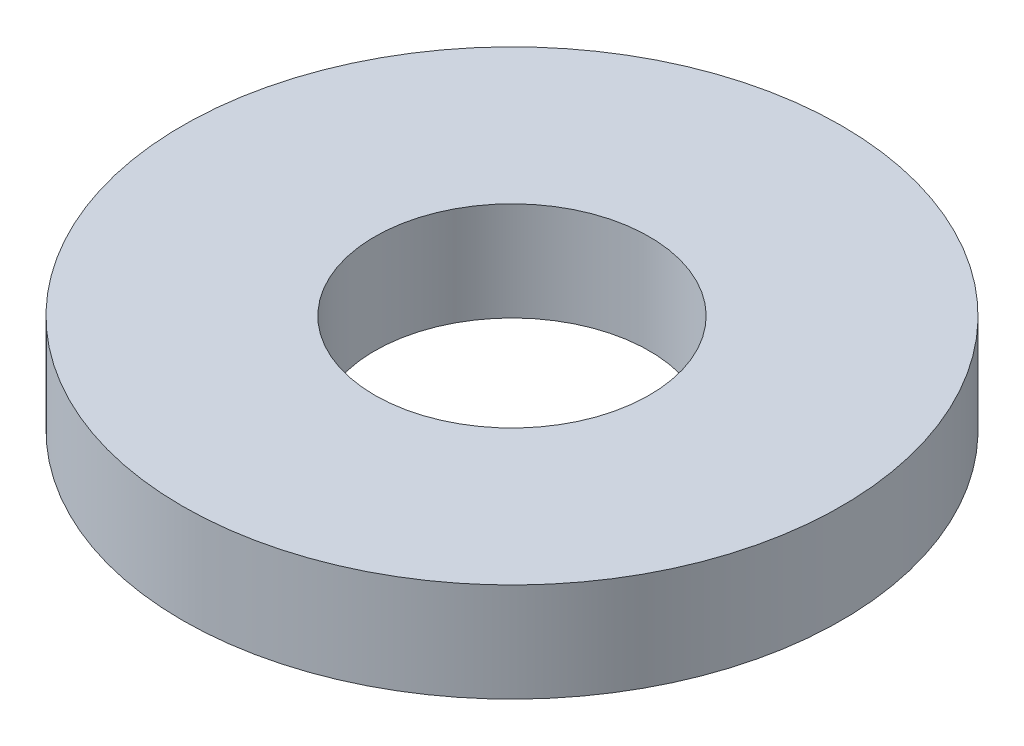
from build123d import *

# Parameters (mm, degrees)
SKETCH1_R           = 60
BOSS_EXTRUDE1_DEPTH = 18
SKETCH2_R           = 25
CUT_EXTRUDE1_DEPTH  = 87.740993769


with BuildPart() as part:
    # Sketch1 → Boss-Extrude1 (new body)
    with BuildSketch(Plane(origin=(0, 0, 0), x_dir=(1, 0, 0), z_dir=(0, 1, 0))):
        Circle(SKETCH1_R)
    extrude(amount=BOSS_EXTRUDE1_DEPTH)

    # Sketch2 → Cut-Extrude1 (cut, through all)
    with BuildSketch(Plane(origin=(0, 0, 0), x_dir=(1, 0, 0), z_dir=(0, 1, 0))):
        Circle(SKETCH2_R)
    extrude(amount=CUT_EXTRUDE1_DEPTH, mode=Mode.SUBTRACT)


solid = part.part
